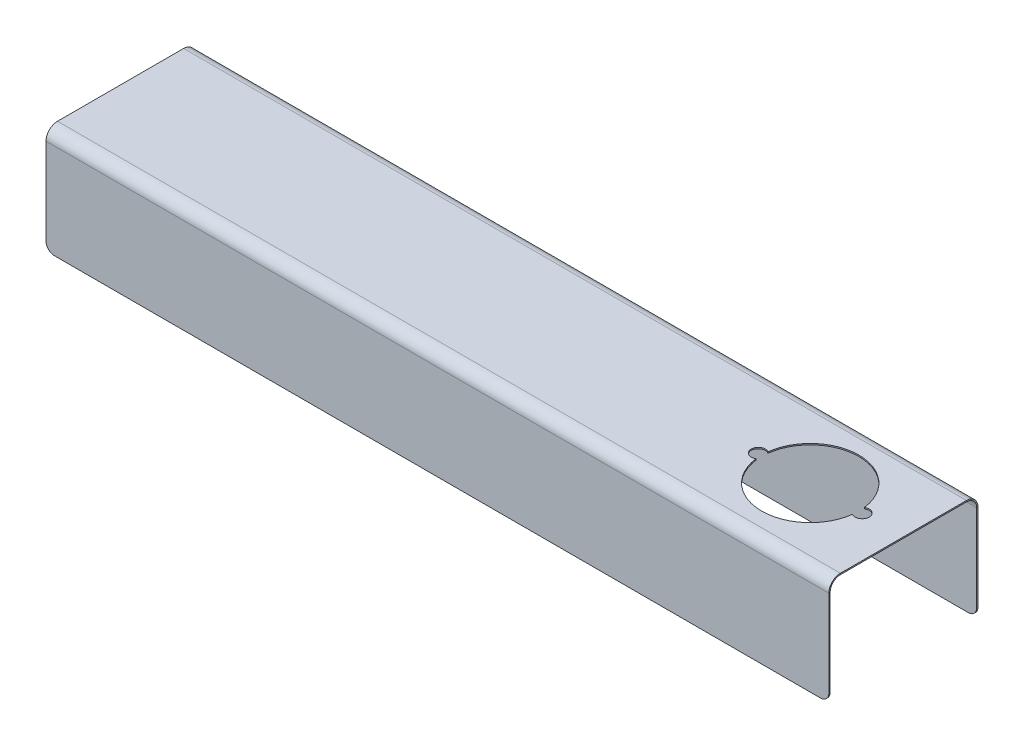
from build123d import *

# Parameters (mm, degrees)
SKETCH1_W                      = 233.3625
SKETCH1_H                      = 0.381
BASE_FLANGE1_DEPTH             = 44.45
EDGE_FLANGE1_STRIP_W           = 7.62
EDGE_FLANGE1_STRIP_H           = 0.381
EDGE_FLANGE1_STRIP_CUT_DEPTH   = 233.3625
EDGE_FLANGE1_STRIP_2_W         = 7.62
EDGE_FLANGE1_STRIP_2_H         = 0.381
EDGE_FLANGE1_STRIP_CUT_2_DEPTH = 233.3625
EDGE_FLANGE1_DEPTH             = 233.3625
EDGE_FLANGE1_BEND_DEPTH        = 233.3625
CUT_EXTRUDE1_DEPTH             = 129.834696808
FILLET1_R                      = 2.54


# Sheet-metal steps are written as plain solids
with BuildPart() as part:
    # Sketch1 → Base-Flange1 (new body)
    with BuildSketch(Plane.XY):
        with Locations((0, 0.1905)):
            Rectangle(SKETCH1_W, SKETCH1_H)
    extrude(amount=BASE_FLANGE1_DEPTH)

    # Edge-Flange1 strip (across the edge) → Edge-Flange1 strip cut (cut)
    with BuildSketch(Plane(origin=(-116.68125, 0, 0), x_dir=(0, 0, 1), z_dir=(1, 0, 0))):
        with Locations((-0.381, -0.1905)):
            Rectangle(EDGE_FLANGE1_STRIP_W, EDGE_FLANGE1_STRIP_H)
    extrude(amount=EDGE_FLANGE1_STRIP_CUT_DEPTH, mode=Mode.SUBTRACT)

    # Edge-Flange1 strip 2 (across the edge) → Edge-Flange1 strip cut 2 (cut)
    with BuildSketch(Plane(origin=(116.68125, 0, 44.45), x_dir=(0, 0, -1), z_dir=(-1, 0, 0))):
        with Locations((-0.381, -0.1905)):
            Rectangle(EDGE_FLANGE1_STRIP_2_W, EDGE_FLANGE1_STRIP_2_H)
    extrude(amount=EDGE_FLANGE1_STRIP_CUT_2_DEPTH, mode=Mode.SUBTRACT)

    # Edge-Flange1 section (across the edge) → Edge-Flange1 (add)
    with BuildSketch(Plane(origin=(-116.68125, 0, 0), x_dir=(0, 0, 1), z_dir=(1, 0, 0))):
        with BuildLine():
            Line((0, 3.048), (0, 31.369))
            Line((0, 31.369), (0.381, 31.369))
            Line((0.381, 31.369), (0.381, 3.048))
            ThreePointArc((0.381, 3.048), (1.273738531, 0.892738531), (3.429, 0))
            Line((3.429, 0), (3.429, -0.381))
            ThreePointArc((3.429, -0.381), (1.004330847, 0.623330847), (0, 3.048))
        make_face()
    extrude(amount=EDGE_FLANGE1_DEPTH)

    # Edge-Flange1 section 2 (across the edge) → Edge-Flange1 bend (add)
    with BuildSketch(Plane(origin=(116.68125, 0, 44.45), x_dir=(0, 0, -1), z_dir=(-1, 0, 0))):
        with BuildLine():
            Line((0, 3.048), (0, 31.369))
            Line((0, 31.369), (0.381, 31.369))
            Line((0.381, 31.369), (0.381, 3.048))
            ThreePointArc((0.381, 3.048), (1.273738531, 0.892738531), (3.429, 0))
            Line((3.429, 0), (3.429, -0.381))
            ThreePointArc((3.429, -0.381), (1.004330847, 0.623330847), (0, 3.048))
        make_face()
    extrude(amount=EDGE_FLANGE1_BEND_DEPTH)

    # Sketch18 → Cut-Extrude1 (cut, through all)
    with BuildSketch(Plane(origin=(0, 0.381, 0), x_dir=(1, 0, 0), z_dir=(0, 1, 0))):
        with BuildLine():
            ThreePointArc((74.530392418, -23.993293511), (88.9, -36.703), (103.269607582, -23.993293511))
            ThreePointArc((103.269607582, -23.993293511), (106.4895, -22.225), (103.269607582, -20.456706489))
            ThreePointArc((103.269607582, -20.456706489), (88.9, -7.747), (74.530392418, -20.456706489))
            ThreePointArc((74.530392418, -20.456706489), (71.3105, -22.225), (74.530392418, -23.993293511))
        make_face()
    extrude(amount=-CUT_EXTRUDE1_DEPTH, mode=Mode.SUBTRACT)

    # Fillet1
    fillet1_edges = [part.edges().sort_by_distance(p)[0] for p in [
        (-116.68125, -31.369, 0.1905),
        (116.68125, -31.369, 0.1905),
        (116.68125, -31.369, 44.2595),
        (-116.68125, -31.369, 44.2595),
    ]]
    fillet(fillet1_edges, radius=FILLET1_R)


solid = part.part
